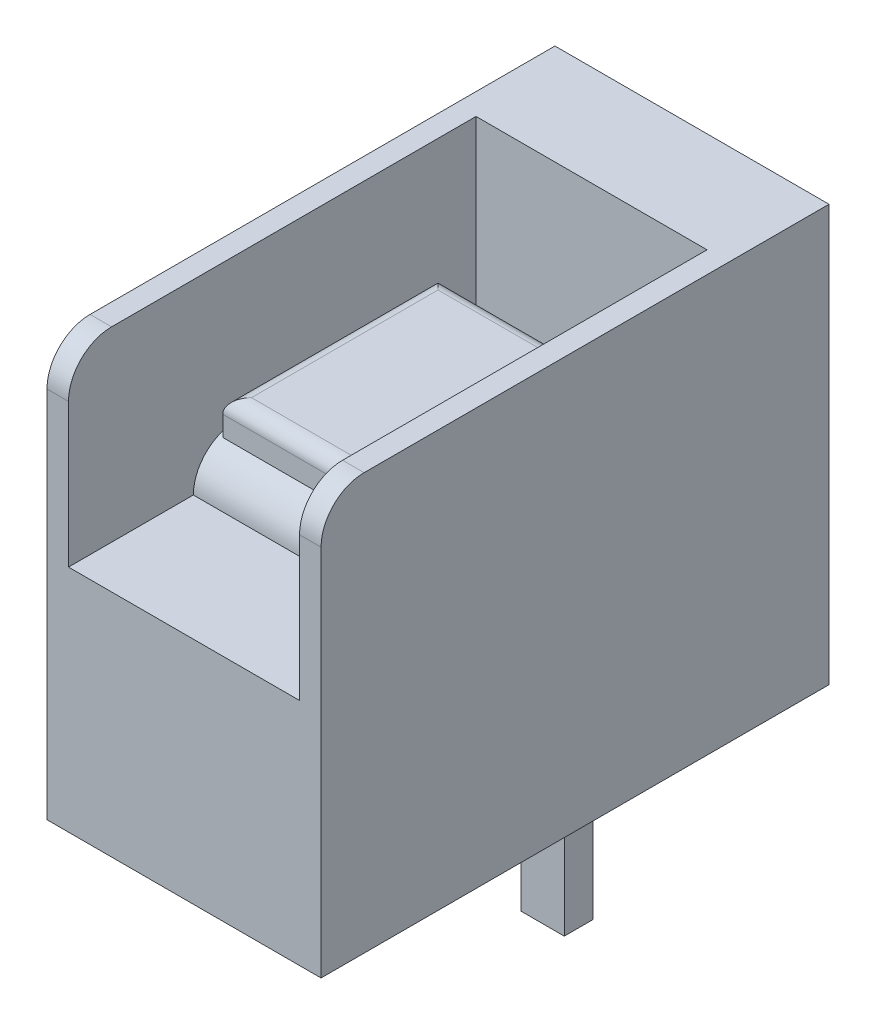
from build123d import *

# Parameters (mm, degrees)
SKETCH_1_W          = 9.55
SKETCH_1_H          = 17.7
EXTRUDE_1_DEPTH     = 14.5
SKETCH_2_W          = 8.05
SKETCH_2_H          = 14.2
CUT_EXTRUDE_1_DEPTH = 6.5
SKETCH_5_W          = 8.05
SKETCH_5_H          = 13.3
CUT_EXTRUDE_4_DEPTH = 2.5
FILLET_1_R          = 1.5
SKETCH_8_W          = 8.05
SKETCH_8_H          = 9
EXTRUDE_1320_DEPTH  = 1.5
FILLET_2_R          = 1.5
SKETCH_10_W         = 7.5
SKETCH_10_H         = 7.5
EXTRUDE_4_DEPTH     = 1.2
FILLET_4_R          = 0.5
SKETCH_11_W         = 1.5
SKETCH_11_H         = 1
EXTRUDE_1_2_DEPTH   = 7


with BuildPart() as part:
    # 草图1 → Extrude 1 (new body)
    with BuildSketch(Plane(origin=(0, 0, 0), x_dir=(1, 0, 0), z_dir=(0, 1, 0))):
        Rectangle(SKETCH_1_W, SKETCH_1_H)
    extrude(amount=EXTRUDE_1_DEPTH)

    # 草图2 → 切除-拉伸1 (cut)
    with BuildSketch(Plane(origin=(0, 14.5, 0), x_dir=(-1, 0, 0), z_dir=(0, 1, 0))):
        with Locations((0, 1.75)):
            Rectangle(SKETCH_2_W, SKETCH_2_H)
    extrude(amount=-CUT_EXTRUDE_1_DEPTH, mode=Mode.SUBTRACT)

    # 草图5 → 切除-拉伸4 (cut)
    with BuildSketch(Plane(origin=(0, 0, -8.85), x_dir=(-1, 0, 0), z_dir=(0, 0, -1))):
        with Locations((0, 6.65)):
            Rectangle(SKETCH_5_W, SKETCH_5_H)
    extrude(amount=-CUT_EXTRUDE_4_DEPTH, mode=Mode.SUBTRACT)

    # 圆角1
    fillet_1_edges = [part.edges().sort_by_distance(p)[0] for p in [
        (4.4, 14.5, 8.85),
        (-4.4, 14.5, 8.85),
    ]]
    fillet(fillet_1_edges, radius=FILLET_1_R)

    # 草图8 → Extrude 1320 (add)
    with BuildSketch(Plane(origin=(0, 8, 0), x_dir=(-1, 0, 0), z_dir=(0, 1, 0))):
        Rectangle(SKETCH_8_W, SKETCH_8_H)
    extrude(amount=EXTRUDE_1320_DEPTH)

    # 圆角2
    fillet_2_edges = [part.edges().sort_by_distance(p)[0] for p in [
        (0, 9.5, -4.5),
        (0, 9.5, 4.5),
    ]]
    fillet(fillet_2_edges, radius=FILLET_2_R - 0.0001)  # a hair under: the kernel refuses the full size

    # 草图10 → 拉伸4 (add)
    with BuildSketch(Plane(origin=(0, 9.5, 0), x_dir=(-1, 0, 0), z_dir=(0, 1, 0))):
        Rectangle(SKETCH_10_W, SKETCH_10_H)
    extrude(amount=EXTRUDE_4_DEPTH)

    # 圆角4
    fillet_4_edges = [part.edges().sort_by_distance(p)[0] for p in [
        (3.75, 10.7, 0),
        (0, 10.7, -3.75),
        (-3.75, 10.7, 0),
        (0, 10.7, 3.75),
    ]]
    fillet(fillet_4_edges, radius=FILLET_4_R)

    # 草图11 → Extrude 1 2 (add)
    with BuildSketch(Plane.XZ):
        with Locations((0, -4.15)):
            Rectangle(SKETCH_11_W, SKETCH_11_H)
    extrude(amount=EXTRUDE_1_2_DEPTH)


solid = part.part
